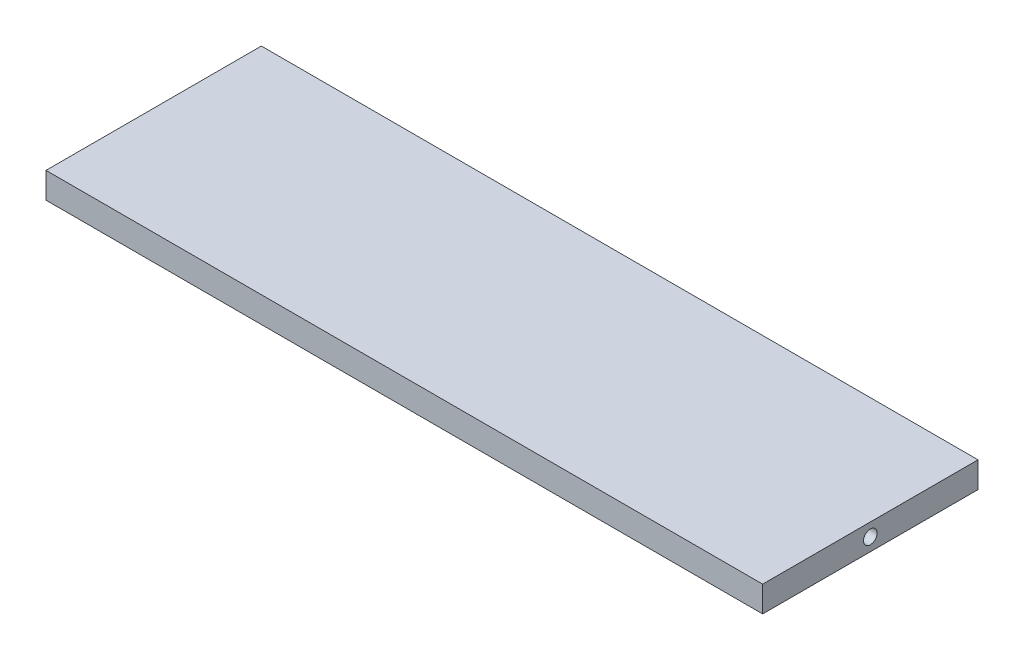
from build123d import *

# Parameters (mm, degrees)
SKETCH1_W           = 105.664
SKETCH1_H           = 31.75
BOSS_EXTRUDE1_DEPTH = 3.81
SKETCH4_R           = 1.0033
CUT_EXTRUDE3_DEPTH  = 7.62
CUT_EXTRUDE4_START  = -7.62
SKETCH5_R           = 1.0033
CUT_EXTRUDE4_DEPTH  = 7.62


with BuildPart() as part:
    # Sketch1 → Boss-Extrude1 (new body)
    with BuildSketch(Plane(origin=(0, 0, 0), x_dir=(1, 0, 0), z_dir=(0, 1, 0))):
        Rectangle(SKETCH1_W, SKETCH1_H)
    extrude(amount=BOSS_EXTRUDE1_DEPTH)

    # Sketch4 → Cut-Extrude3 (cut)
    with BuildSketch(Plane(origin=(52.832, 0, 0), x_dir=(0, 0, -1), z_dir=(1, 0, 0))):
        with Locations((0, 1.905)):
            Circle(SKETCH4_R)
    extrude(amount=-CUT_EXTRUDE3_DEPTH, mode=Mode.SUBTRACT)

    # Sketch5 → Cut-Extrude4 (cut)
    with BuildSketch(Plane.ZY.offset(52.832).offset(CUT_EXTRUDE4_START)):
        with Locations((0, 1.905)):
            Circle(SKETCH5_R)
    extrude(amount=CUT_EXTRUDE4_DEPTH, mode=Mode.SUBTRACT)


solid = part.part
